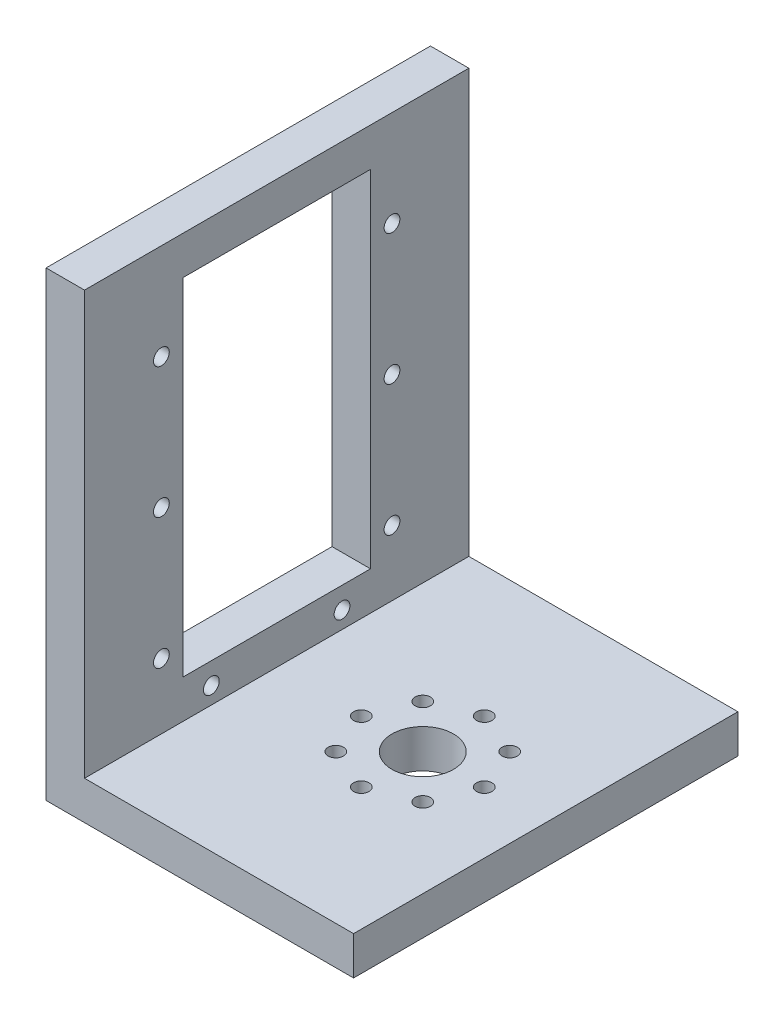
from build123d import *

# Parameters (mm, degrees)
SKETCH1_W           = 40
SKETCH1_H           = 50
SKETCH1_R           = 4
SKETCH1_R_2         = 1
BOSS_EXTRUDE1_DEPTH = 5
SKETCH3_W           = 5
SKETCH3_H           = 50
BOSS_EXTRUDE2_DEPTH = 60
SKETCH4_R           = 1.025
SKETCH4_W           = 24.4
SKETCH4_H           = 45
CUT_EXTRUDE1_DEPTH  = 88.749643874


with BuildPart() as part:
    # Sketch1 → Boss-Extrude1 (new body)
    with BuildSketch(Plane(origin=(0, 0, 0), x_dir=(1, 0, 0), z_dir=(0, 1, 0))):
        with Locations((20, 25)):
            Rectangle(SKETCH1_W, SKETCH1_H)
        with Locations((24, 25)):
            Circle(SKETCH1_R, mode=Mode.SUBTRACT)
        with Locations((24, 33)):
            Circle(SKETCH1_R_2, mode=Mode.SUBTRACT)
        with Locations((29.656854249, 30.656854249)):
            Circle(SKETCH1_R_2, mode=Mode.SUBTRACT)
        with Locations((32, 25)):
            Circle(SKETCH1_R_2, mode=Mode.SUBTRACT)
        with Locations((29.656854249, 19.343145751)):
            Circle(SKETCH1_R_2, mode=Mode.SUBTRACT)
        with Locations((24, 17)):
            Circle(SKETCH1_R_2, mode=Mode.SUBTRACT)
        with Locations((18.343145751, 19.343145751)):
            Circle(SKETCH1_R_2, mode=Mode.SUBTRACT)
        with Locations((16, 25)):
            Circle(SKETCH1_R_2, mode=Mode.SUBTRACT)
        with Locations((18.343145751, 30.656854249)):
            Circle(SKETCH1_R_2, mode=Mode.SUBTRACT)
    extrude(amount=BOSS_EXTRUDE1_DEPTH)

    # Sketch3 → Boss-Extrude2 (add)
    with BuildSketch(Plane(origin=(0, 0, 0), x_dir=(1, 0, 0), z_dir=(0, 1, 0))):
        with Locations((2.5, 25)):
            Rectangle(SKETCH3_W, SKETCH3_H)
    extrude(amount=BOSS_EXTRUDE2_DEPTH)

    # Sketch4 → Cut-Extrude1 (cut, through all)
    with BuildSketch(Plane.ZY):
        with Locations((-40, 47.5)):
            Circle(SKETCH4_R)
        with Locations((-10, 47.5)):
            Circle(SKETCH4_R)
        with Locations((-40, 30.5)):
            Circle(SKETCH4_R)
        with Locations((-10, 30.5)):
            Circle(SKETCH4_R)
        with Locations((-40, 13.5)):
            Circle(SKETCH4_R)
        with Locations((-33.5, 7.2)):
            Circle(SKETCH4_R)
        with Locations((-16.5, 7.2)):
            Circle(SKETCH4_R)
        with Locations((-10, 13.5)):
            Circle(SKETCH4_R)
        with Locations((-25, 32.5)):
            Rectangle(SKETCH4_W, SKETCH4_H)
    extrude(amount=-CUT_EXTRUDE1_DEPTH, mode=Mode.SUBTRACT)


solid = part.part
